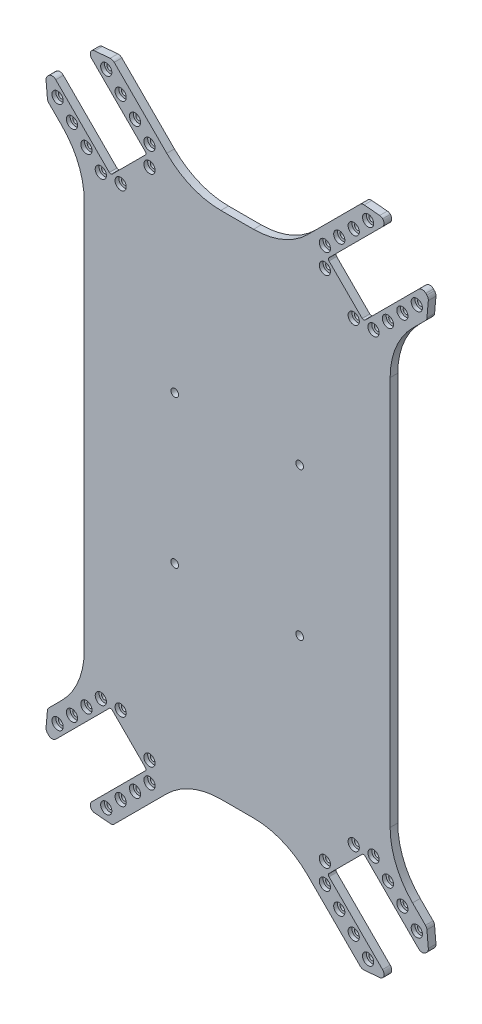
from build123d import *
from OCP.BRepFilletAPI import BRepFilletAPI_MakeChamfer

# Parameters (mm, degrees)
BOSS_EXTRUDE1_DEPTH                                 = 3
CUT_EXTRUDE1_DEPTH                                  = 156.018451039
CBORE_FOR_M2_HEX_SOCKET_HEAD_CAP_SCREW3_D           = 2.4
CBORE_FOR_M2_HEX_SOCKET_HEAD_CAP_SCREW3_CBORE_D     = 4.4
CBORE_FOR_M2_HEX_SOCKET_HEAD_CAP_SCREW3_CBORE_DEPTH = 1.5
SKETCH14_R                                          = 1.5
CUT_EXTRUDE2_DEPTH                                  = 156.018451039
FILLET1_R                                           = 30
CHAMFER1_SIZE                                       = 5
CHAMFER1_SIZE2                                      = 5.958767963
FILLET2_R                                           = 2
FILLET3_R                                           = 0.8


with BuildPart() as part:
    # Sketch3 → Boss-Extrude1 (new body)
    with BuildSketch(Plane.XY):
        Polygon((-52.42479618, 133.587747084), (-78.587747084, 107.42479618), (-60, 88.837049096), (-60, 0), (0, 0), (0, 100), (-18.837049096, 100), align=None)
    extrude(amount=BOSS_EXTRUDE1_DEPTH)

    # Sketch5 → Cut-Extrude1 (cut, through all)
    with BuildSketch(Plane.XY.offset(3)):
        Polygon((-35.454233431, 104.596369055), (-49.596369055, 90.454233431), (-75.405766569, 116.263630945), (-61.263630945, 130.405766569), align=None)
    extrude(amount=-CUT_EXTRUDE1_DEPTH, mode=Mode.SUBTRACT)

    # CBORE for M2 Hex Socket Head Cap Screw3 (through all)
    with Locations(Plane.XY.offset(3)):
        with Locations((-70.4560191, 106.364136008), (-64.799164851, 100.707281759), (-59.142310601, 95.050427509), (-53.485456352, 89.39357326), (-45.707281759, 89.39357326), (-34.39357326, 100.707281759), (-34.39357326, 108.485456352), (-40.050427509, 114.142310601), (-45.707281759, 119.799164851), (-51.364136008, 125.4560191)):
            CounterBoreHole(CBORE_FOR_M2_HEX_SOCKET_HEAD_CAP_SCREW3_D / 2, CBORE_FOR_M2_HEX_SOCKET_HEAD_CAP_SCREW3_CBORE_D / 2, CBORE_FOR_M2_HEX_SOCKET_HEAD_CAP_SCREW3_CBORE_DEPTH)

    # Sketch14 → Cut-Extrude2 (cut, through all)
    with BuildSketch(Plane.XY.offset(3)):
        with Locations((-24.5, 29)):
            Circle(SKETCH14_R)
    extrude(amount=-CUT_EXTRUDE2_DEPTH, mode=Mode.SUBTRACT)

    # Fillet1
    fillet1_edges = [part.edges().sort_by_distance(p)[0] for p in [
        (-18.837049096, 100, 1.5),
        (-60, 88.837049096, 1.5),
    ]]
    fillet(fillet1_edges, radius=FILLET1_R)

    # Chamfer1: one chamfer whose edges measure the first distance from different faces: ONE call of the kernel's chamfer builder (chamfer() names one face for all edges)
    chamfer1_edges_1 = [part.edges().sort_by_distance(p)[0] for p in [
        (-78.587747084, 107.42479618, 1.5),
    ]]
    chamfer1_side_1 = [part.faces().sort_by_distance(p)[0] for p in [
        (-75.582543264, 110.43, 1.5),
    ]]
    chamfer1_edges_2 = [part.edges().sort_by_distance(p)[0] for p in [
        (-52.42479618, 133.587747084, 1.5),
    ]]
    chamfer1_side_2 = [part.faces().sort_by_distance(p)[0] for p in [
        (-40.02432092, 121.187271824, 1.5),
    ]]
    chamfer1 = BRepFilletAPI_MakeChamfer(part.part.solid().wrapped)
    for e in chamfer1_edges_1:
        chamfer1.Add(CHAMFER1_SIZE, CHAMFER1_SIZE2, e.wrapped, chamfer1_side_1[0].wrapped)  # the first distance lies on this face
    for e in chamfer1_edges_2:
        chamfer1.Add(CHAMFER1_SIZE, CHAMFER1_SIZE2, e.wrapped, chamfer1_side_2[0].wrapped)  # the first distance lies on this face
    add(Compound.cast(chamfer1.Shape()), mode=Mode.REPLACE)

    # Fillet2
    # the kernel refuses this fillet: 2 mm, written as the material it takes off along each edge
    with BuildSketch(Plane(origin=(-56.638281414, 129.37426185, -1.819851171), x_dir=(0.9961946980917452, 0.08715574274766212, 0), z_dir=(0, 0, 1)), Plane(origin=(-74.37426185, 103.211310946, -1.819851171), x_dir=(-0.08715574274768319, 0.9961946980917433, 0), z_dir=(0, 0, 1))) as fillet2_piece_1:
        with BuildLine():
            CenterArc((FILLET2_R * 0.363970234266, -FILLET2_R), FILLET2_R, 90, 40)
            Line((-FILLET2_R * 0.27881737542, -FILLET2_R * 0.233955556881), (0, 0))
            Line((0, 0), (FILLET2_R * 0.363970234266, 0))
        make_face()
    extrude(amount=6.639702343, mode=Mode.SUBTRACT)
    with BuildSketch(Plane(origin=(-48.889262274, 130.052213178, -2.331538291), x_dir=(0.7071067811865552, -0.7071067811865399, 0), z_dir=(0, 0, 1)), Plane(origin=(-75.052213178, 110.960330086, -2.331538291), x_dir=(0.7071067811865399, 0.7071067811865551, 0), z_dir=(0, 0, 1))) as fillet2_piece_2:
        with BuildLine():
            CenterArc((FILLET2_R * 0.466307658155, -FILLET2_R), FILLET2_R, 90, 50)
            Line((-FILLET2_R * 0.299736784964, -FILLET2_R * 0.357212390313), (0, 0))
            Line((0, 0), (FILLET2_R * 0.466307658155, 0))
        make_face()
    extrude(amount=7.663076582, mode=Mode.SUBTRACT)
    with BuildSketch(Plane(origin=(-58.43520382, 127.577339444, 8), x_dir=(0.7071067811865476, 0.7071067811865476, 0), z_dir=(0, 0, -1))) as fillet2_piece_3:
        with BuildLine():
            CenterArc((FILLET2_R, FILLET2_R), FILLET2_R, 180, 90)
            Line((0, FILLET2_R), (0, 0))
            Line((0, 0), (FILLET2_R, 0))
        make_face()
    extrude(amount=13, mode=Mode.SUBTRACT)
    with BuildSketch(Plane(origin=(-72.577339444, 113.43520382, -5), x_dir=(0.707106781186551, -0.7071067811865439, 0), z_dir=(0, 0, 1))) as fillet2_piece_4:
        with BuildLine():
            CenterArc((FILLET2_R, -FILLET2_R), FILLET2_R, 90, 90)
            Line((0, -FILLET2_R), (0, 0))
            Line((0, 0), (FILLET2_R, 0))
        make_face()
    extrude(amount=13, mode=Mode.SUBTRACT)

    # Fillet3
    fillet3_edges = [part.edges().sort_by_distance(p)[0] for p in [
        (-49.596369055, 90.454233431, 1.5),
        (-35.454233431, 104.596369055, 1.5),
    ]]
    fillet(fillet3_edges, radius=FILLET3_R)

    # Mirror1: part across plane


with BuildPart() as part_1:
    add(part.part)
    add(part.part.mirror(Plane(origin=(0, 0, 0), x_dir=(0, 0, 1), z_dir=(1, 0, 0))))

    # Mirror2: part across plane


with BuildPart() as part_2:
    add(part_1.part)
    add(part_1.part.mirror(Plane.ZX))


solid = part_2.part
